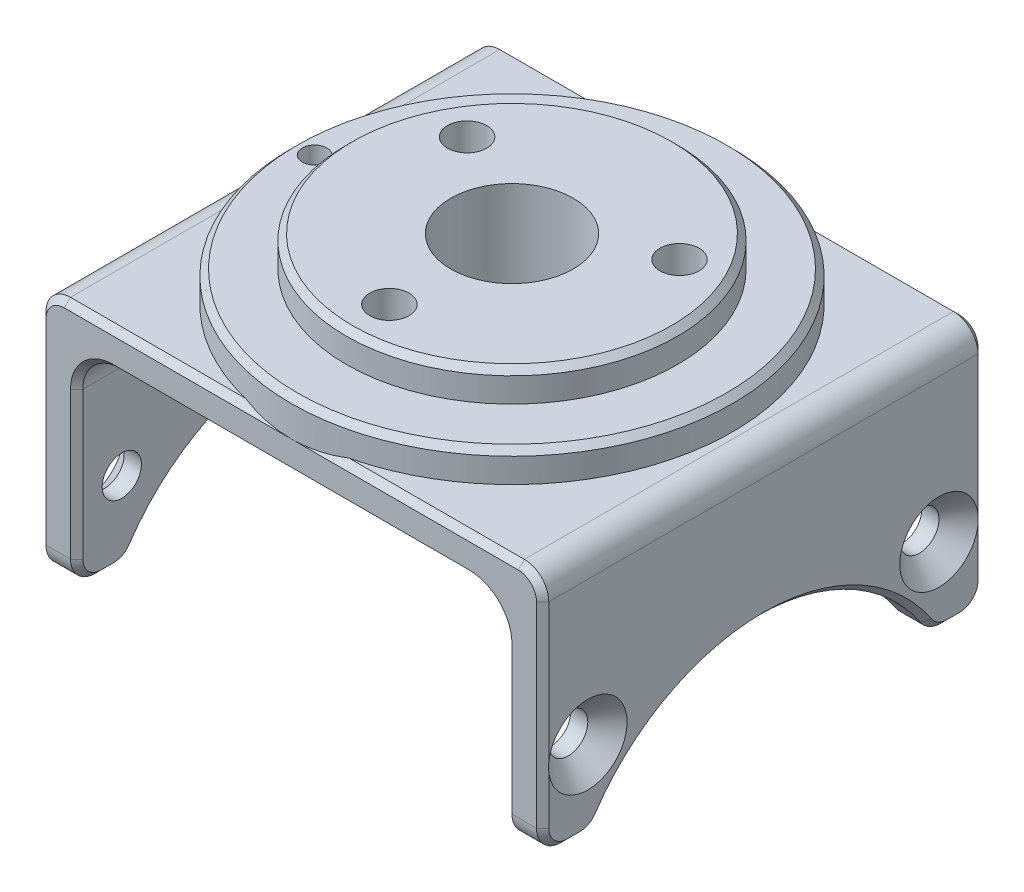
from build123d import *

# Parameters (mm, degrees)
EXTRUDE_1_DEPTH              = 18
SKETCH_3_R                   = 16
CUT_EXTRUDE_1_DEPTH          = 46
SKETCH_11_R                  = 13.5
EXTRUDE_2_DEPTH              = 5
SKETCH_12_R                  = 18
EXTRUDE_5_DEPTH              = 2.5
HOLE_WIZARD_M3_3_D           = 3.2
HOLE_WIZARD_M3_3_CSINK_D     = 6.4
HOLE_WIZARD_M3_3_CSINK_ANGLE = 90
SKETCH_9_R                   = 5
CUT_EXTRUDE_2_DEPTH          = 46
F_2_0MM_1_D                  = 2
F_2_0MM_1_DEPTH              = 4.2
F_2_0MM_1_TIP                = 0.600860619
HOLE_WIZARD_M3_1_D           = 3.2
HOLE_WIZARD_M3_1_DEPTH       = 6
HOLE_WIZARD_M3_1_CSINK_D     = 6.4
HOLE_WIZARD_M3_1_CSINK_ANGLE = 90
HOLE_WIZARD_M3_1_TIP         = 0.96137699
HOLE_WIZARD_M3_2_D           = 3.2
HOLE_WIZARD_M3_2_DEPTH       = 6
HOLE_WIZARD_M3_2_CSINK_D     = 6.4
HOLE_WIZARD_M3_2_CSINK_ANGLE = 90
HOLE_WIZARD_M3_2_TIP         = 0.96137699
FILLET_1_R                   = 2
FILLET_2_R                   = 3
FILLET_3_R                   = 2
CHAMFER_3_SIZE               = 0.5


with BuildPart() as part:
    # 草图2 → 凸台-拉伸1 (new, symmetric)
    with BuildSketch(Plane.XY):
        Polygon((17.5, 17), (17.5, 0), (20.5, 0), (20.5, 20), (-20.5, 20), (-20.5, 0), (-17.5, 0), (-17.5, 17), align=None)
    extrude(amount=EXTRUDE_1_DEPTH, both=True)

    # 草图3 → 切除-拉伸1 (cut)
    with BuildSketch(Plane(origin=(20.5, 0, 0), x_dir=(0, 0, -1), z_dir=(1, 0, 0))):
        with Locations((0, -8)):
            Circle(SKETCH_3_R)
    extrude(amount=-CUT_EXTRUDE_1_DEPTH, mode=Mode.SUBTRACT)

    # 草图11 → 凸台-拉伸2 (add)
    with BuildSketch(Plane(origin=(0, 20, 0), x_dir=(1, 0, 0), z_dir=(0, 1, 0))):
        with Locations(Location((0, 0, 0), (0, 0, 270))):
            Circle(SKETCH_11_R)
    extrude(amount=EXTRUDE_2_DEPTH)

    # 草图12 → 凸台-拉伸5 (add)
    with BuildSketch(Plane(origin=(0, 20, 0), x_dir=(1, 0, 0), z_dir=(0, 1, 0))):
        with Locations(Location((0, 0, 0), (0, 0, 270))):
            Circle(SKETCH_12_R)
    extrude(amount=EXTRUDE_5_DEPTH)

    # M3 开槽半沉头螺钉的锥形沉头孔3 (through all)
    with Locations(Plane.XZ.offset(-17)):
        with Locations((0, 10), (8.660254038, -5), (-8.660254038, -5)):
            CounterSinkHole(HOLE_WIZARD_M3_3_D / 2, HOLE_WIZARD_M3_3_CSINK_D / 2, counter_sink_angle=HOLE_WIZARD_M3_3_CSINK_ANGLE)

    # 草图9 → 切除-拉伸2 (cut)
    with BuildSketch(Plane.XZ.offset(-17)):
        with Locations(Location((0, 0, 0), (0, 0, 270))):
            Circle(SKETCH_9_R)
    extrude(amount=-CUT_EXTRUDE_2_DEPTH, mode=Mode.SUBTRACT)

    # Ø2.0mm 暗销孔1
    with Locations(Plane(origin=(0, 22.5, 0), x_dir=(1, 0, 0), z_dir=(0, 1, 0))):
        with Locations((-16.1, 0)):
            Hole(F_2_0MM_1_D / 2, depth=F_2_0MM_1_DEPTH)
            with Locations((0, 0, -(F_2_0MM_1_DEPTH + F_2_0MM_1_TIP / 2))):  # 118° drill point
                Cone(0, F_2_0MM_1_D / 2, F_2_0MM_1_TIP, mode=Mode.SUBTRACT)

    # M3 开槽半沉头螺钉的锥形沉头孔1
    with Locations(Plane(origin=(20.5, 0, 0), x_dir=(0, 0, -1), z_dir=(1, 0, 0))):
        with Locations((14.318912319, 6.318912319), (-14.318912319, 6.318912319)):
            CounterSinkHole(HOLE_WIZARD_M3_1_D / 2, HOLE_WIZARD_M3_1_CSINK_D / 2, depth=HOLE_WIZARD_M3_1_DEPTH, counter_sink_angle=HOLE_WIZARD_M3_1_CSINK_ANGLE)
            with Locations((0, 0, -(HOLE_WIZARD_M3_1_DEPTH + HOLE_WIZARD_M3_1_TIP / 2))):  # 118° drill point
                Cone(0, HOLE_WIZARD_M3_1_D / 2, HOLE_WIZARD_M3_1_TIP, mode=Mode.SUBTRACT)

    # M3 开槽半沉头螺钉的锥形沉头孔2
    with Locations(Plane.ZY.offset(20.5)):
        with Locations((-14.318912319, 6.318912319), (14.318912319, 6.318912319)):
            CounterSinkHole(HOLE_WIZARD_M3_2_D / 2, HOLE_WIZARD_M3_2_CSINK_D / 2, depth=HOLE_WIZARD_M3_2_DEPTH, counter_sink_angle=HOLE_WIZARD_M3_2_CSINK_ANGLE)
            with Locations((0, 0, -(HOLE_WIZARD_M3_2_DEPTH + HOLE_WIZARD_M3_2_TIP / 2))):  # 118° drill point
                Cone(0, HOLE_WIZARD_M3_2_D / 2, HOLE_WIZARD_M3_2_TIP, mode=Mode.SUBTRACT)

    # 圆角1
    fillet_1_edges = [part.edges().sort_by_distance(p)[0] for p in [
        (19, 0, -18),
        (19, 0, 18),
        (-19, 0, 18),
        (19, 0, 13.856406461),
        (19, 0, -13.856406461),
        (-19, 0, -13.856406461),
        (-19, 0, 13.856406461),
        (-19, 0, -18),
    ]]
    fillet(fillet_1_edges, radius=FILLET_1_R)

    # 圆角2
    fillet_2_edges = [part.edges().sort_by_distance(p)[0] for p in [
        (-17.5, 17, 0),
        (17.5, 17, 0),
    ]]
    fillet(fillet_2_edges, radius=FILLET_2_R)

    # 圆角3
    fillet_3_edges = [part.edges().sort_by_distance(p)[0] for p in [
        (-20.5, 20, 0),
        (20.5, 20, 0),
    ]]
    fillet(fillet_3_edges, radius=FILLET_3_R)

    # 倒角3
    # the kernel refuses this chamfer: 0.5 mm, written as the material it takes off along each edge
    with BuildSketch(Plane(origin=(20.5, 0, -16), x_dir=(0.02749587661058908, 0.9996219169112968, 0), z_dir=(0, 0, 1)), Plane(origin=(20.5, 0, 14.966629547), x_dir=(0.02749587661058908, 0.9996219169112968, 0), z_dir=(0, 0, 1))) as chamfer_3_piece_1:
        Polygon((CHAMFER_3_SIZE * 0.999621916911, CHAMFER_3_SIZE * 0.0274958766106), (-CHAMFER_3_SIZE * 0.0274958766106, CHAMFER_3_SIZE * 0.999621916911), (0, 0), align=None)
    extrude(amount=1.033370453, mode=Mode.SUBTRACT)
    with BuildSketch(Plane(origin=(17.5, 0, -16), x_dir=(-0.02749587661058908, 0.9996219169112968, 0), z_dir=(0, 0, 1)), Plane(origin=(17.5, 0, 14.966629547), x_dir=(-0.02749587661058908, 0.9996219169112968, 0), z_dir=(0, 0, 1)), Plane(origin=(-17.5, 0, -14.966629547), x_dir=(0.02749587661058908, 0.9996219169112968, 0), z_dir=(0, 0, -1)), Plane(origin=(-20.5, 0, -16), x_dir=(-0.02749587661058908, 0.9996219169112968, 0), z_dir=(0, 0, 1)), Plane(origin=(-17.5, 0, 16), x_dir=(0.02749587661058908, 0.9996219169112968, 0), z_dir=(0, 0, -1)), Plane(origin=(-20.5, 0, 14.966629547), x_dir=(-0.02749587661058908, 0.9996219169112968, 0), z_dir=(0, 0, 1))) as chamfer_3_piece_2:
        Polygon((CHAMFER_3_SIZE * 0.999621916911, -CHAMFER_3_SIZE * 0.0274958766106), (-CHAMFER_3_SIZE * 0.0274958766106, -CHAMFER_3_SIZE * 0.999621916911), (0, 0), align=None)
    extrude(amount=1.033370453, mode=Mode.SUBTRACT)
    with BuildSketch(Plane(origin=(20.5, -8, 0), x_dir=(0, 0.5555555555555556, -0.8314794192830981), z_dir=(0, -0.8314794192830981, -0.5555555555555556))) as chamfer_3_piece_3:
        Polygon((16 + CHAMFER_3_SIZE, 0), (16, -CHAMFER_3_SIZE), (16, 0), align=None)
    revolve(axis=Axis((20.5, -8, 0), (1, 0, 0)), revolution_arc=112.502022808, mode=Mode.SUBTRACT)
    with BuildSketch(Plane(origin=(20.5, 2, -18), x_dir=(0.027495876610589005, 0, 0.9996219169112968), z_dir=(0, 1, 0)), Plane(origin=(20.5, 2, 18), x_dir=(-0.9996219169112968, 0, 0.027495876610589005), z_dir=(0, 1, 0)), Plane(origin=(-20.5, 18, -18), x_dir=(-0.027495876610589005, 0, 0.9996219169112968), z_dir=(0, -1, 0)), Plane(origin=(-20.5, 18, 18), x_dir=(0.9996219169112968, 0, 0.027495876610589005), z_dir=(0, -1, 0))) as chamfer_3_piece_4:
        Polygon((CHAMFER_3_SIZE * 0.999621916911, -CHAMFER_3_SIZE * 0.0274958766106), (-CHAMFER_3_SIZE * 0.0274958766106, -CHAMFER_3_SIZE * 0.999621916911), (0, 0), align=None)
    extrude(amount=16, mode=Mode.SUBTRACT)
    with BuildSketch(Plane(origin=(20.5, 2, 16), x_dir=(0, -1, 0), z_dir=(0, 0, -1))) as chamfer_3_piece_5:
        Polygon((2 - CHAMFER_3_SIZE, 0), (2, CHAMFER_3_SIZE), (2, 0), align=None)
    revolve(axis=Axis((20.5, 2, 16), (-1, 0, 0)), revolution_arc=90, mode=Mode.SUBTRACT)
    with BuildSketch(Plane(origin=(20.5, 2, 14.966629547), x_dir=(0, -0.555555555555556, -0.8314794192830979), z_dir=(0, 0.8314794192830979, -0.555555555555556))) as chamfer_3_piece_6:
        Polygon((2 - CHAMFER_3_SIZE, 0), (2, CHAMFER_3_SIZE), (2, 0), align=None)
    revolve(axis=Axis((20.5, 2, 14.966629547), (-1, 0, 0)), revolution_arc=56.251011404, mode=Mode.SUBTRACT)
    with BuildSketch(Plane(origin=(20.5, 2, -14.966629547), x_dir=(0, -0.5555555555555557, 0.8314794192830981), z_dir=(0, 0.8314794192830981, 0.5555555555555557))) as chamfer_3_piece_7:
        Polygon((2 - CHAMFER_3_SIZE, 0), (2, -CHAMFER_3_SIZE), (2, 0), align=None)
    revolve(axis=Axis((20.5, 2, -14.966629547), (1, 0, 0)), revolution_arc=56.251011404, mode=Mode.SUBTRACT)
    with BuildSketch(Plane(origin=(20.5, 2, -16), x_dir=(0, -1, 0), z_dir=(0, 0, 1))) as chamfer_3_piece_8:
        Polygon((2 - CHAMFER_3_SIZE, 0), (2, -CHAMFER_3_SIZE), (2, 0), align=None)
    revolve(axis=Axis((20.5, 2, -16), (1, 0, 0)), revolution_arc=90, mode=Mode.SUBTRACT)
    with BuildSketch(Plane(origin=(-17.5, 2, -18), x_dir=(0.027495876610589005, 0, 0.9996219169112968), z_dir=(0, 1, 0)), Plane(origin=(-17.5, 2, 18), x_dir=(-0.9996219169112968, 0, 0.027495876610589005), z_dir=(0, 1, 0)), Plane(origin=(17.5, 14, -18), x_dir=(-0.027495876610589005, 0, 0.9996219169112968), z_dir=(0, -1, 0)), Plane(origin=(17.5, 14, 18), x_dir=(0.9996219169112968, 0, 0.027495876610589005), z_dir=(0, -1, 0))) as chamfer_3_piece_9:
        Polygon((CHAMFER_3_SIZE * 0.999621916911, -CHAMFER_3_SIZE * 0.0274958766106), (-CHAMFER_3_SIZE * 0.0274958766106, -CHAMFER_3_SIZE * 0.999621916911), (0, 0), align=None)
    extrude(amount=12, mode=Mode.SUBTRACT)
    with BuildSketch(Plane(origin=(17.5, -8, 0), x_dir=(0, 0.5555555555555556, -0.8314794192830981), z_dir=(0, -0.8314794192830981, -0.5555555555555556))) as chamfer_3_piece_10:
        Polygon((16 + CHAMFER_3_SIZE, 0), (16, CHAMFER_3_SIZE), (16, 0), align=None)
    revolve(axis=Axis((17.5, -8, 0), (1, 0, 0)), revolution_arc=112.502022808, mode=Mode.SUBTRACT)
    with BuildSketch(Plane(origin=(17.5, 2, 16), x_dir=(0, -1, 0), z_dir=(0, 0, -1))) as chamfer_3_piece_11:
        Polygon((2, -CHAMFER_3_SIZE), (2 - CHAMFER_3_SIZE, 0), (2, 0), align=None)
    revolve(axis=Axis((17.5, 2, 16), (-1, 0, 0)), revolution_arc=90, mode=Mode.SUBTRACT)
    with BuildSketch(Plane(origin=(17.5, 2, 14.966629547), x_dir=(0, -0.5555555555555564, -0.8314794192830977), z_dir=(0, 0.8314794192830977, -0.5555555555555564))) as chamfer_3_piece_12:
        Polygon((2 - CHAMFER_3_SIZE, 0), (2, -CHAMFER_3_SIZE), (2, 0), align=None)
    revolve(axis=Axis((17.5, 2, 14.966629547), (-1, 0, 0)), revolution_arc=56.251011404, mode=Mode.SUBTRACT)
    with BuildSketch(Plane(origin=(17.5, 2, -14.966629547), x_dir=(0, -0.5555555555555557, 0.8314794192830981), z_dir=(0, 0.8314794192830981, 0.5555555555555557))) as chamfer_3_piece_13:
        Polygon((2 - CHAMFER_3_SIZE, 0), (2, CHAMFER_3_SIZE), (2, 0), align=None)
    revolve(axis=Axis((17.5, 2, -14.966629547), (1, 0, 0)), revolution_arc=56.251011404, mode=Mode.SUBTRACT)
    with BuildSketch(Plane(origin=(17.5, 2, -16), x_dir=(0, -1, 0), z_dir=(0, 0, 1))) as chamfer_3_piece_14:
        Polygon((2 - CHAMFER_3_SIZE, 0), (2, CHAMFER_3_SIZE), (2, 0), align=None)
    revolve(axis=Axis((17.5, 2, -16), (1, 0, 0)), revolution_arc=90, mode=Mode.SUBTRACT)
    with BuildSketch(Plane(origin=(-17.5, -8, 0), x_dir=(0, 0.5555555555555556, -0.8314794192830981), z_dir=(0, -0.8314794192830981, -0.5555555555555556))) as chamfer_3_piece_15:
        Polygon((16 + CHAMFER_3_SIZE, 0), (16, -CHAMFER_3_SIZE), (16, 0), align=None)
    revolve(axis=Axis((-17.5, -8, 0), (1, 0, 0)), revolution_arc=112.502022808, mode=Mode.SUBTRACT)
    with BuildSketch(Plane(origin=(-17.5, 2, 16), x_dir=(0, -1, 0), z_dir=(0, 0, -1))) as chamfer_3_piece_16:
        Polygon((2, CHAMFER_3_SIZE), (2 - CHAMFER_3_SIZE, 0), (2, 0), align=None)
    revolve(axis=Axis((-17.5, 2, 16), (-1, 0, 0)), revolution_arc=90, mode=Mode.SUBTRACT)
    with BuildSketch(Plane(origin=(-17.5, 2, 14.966629547), x_dir=(0, -1, 0), z_dir=(0, 0, 1))) as chamfer_3_piece_17:
        Polygon((2 - CHAMFER_3_SIZE, 0), (2, -CHAMFER_3_SIZE), (2, 0), align=None)
    revolve(axis=Axis((-17.5, 2, 14.966629547), (1, 0, 0)), revolution_arc=56.251011404, mode=Mode.SUBTRACT)
    with BuildSketch(Plane(origin=(-17.5, 2, -14.966629547), x_dir=(0, -0.5555555555555557, 0.8314794192830981), z_dir=(0, 0.8314794192830981, 0.5555555555555557))) as chamfer_3_piece_18:
        Polygon((2 - CHAMFER_3_SIZE, 0), (2, -CHAMFER_3_SIZE), (2, 0), align=None)
    revolve(axis=Axis((-17.5, 2, -14.966629547), (1, 0, 0)), revolution_arc=56.251011404, mode=Mode.SUBTRACT)
    with BuildSketch(Plane(origin=(-17.5, 2, -16), x_dir=(0, -1, 0), z_dir=(0, 0, 1))) as chamfer_3_piece_19:
        Polygon((2 - CHAMFER_3_SIZE, 0), (2, -CHAMFER_3_SIZE), (2, 0), align=None)
    revolve(axis=Axis((-17.5, 2, -16), (1, 0, 0)), revolution_arc=90, mode=Mode.SUBTRACT)
    with BuildSketch(Plane(origin=(-20.5, -8, 0), x_dir=(0, 0.5555555555555556, -0.8314794192830981), z_dir=(0, -0.8314794192830981, -0.5555555555555556))) as chamfer_3_piece_20:
        Polygon((16 + CHAMFER_3_SIZE, 0), (16, CHAMFER_3_SIZE), (16, 0), align=None)
    revolve(axis=Axis((-20.5, -8, 0), (1, 0, 0)), revolution_arc=112.502022808, mode=Mode.SUBTRACT)
    with BuildSketch(Plane(origin=(-20.5, 2, 16), x_dir=(0, -1, 0), z_dir=(0, 0, -1))) as chamfer_3_piece_21:
        Polygon((2 - CHAMFER_3_SIZE, 0), (2, -CHAMFER_3_SIZE), (2, 0), align=None)
    revolve(axis=Axis((-20.5, 2, 16), (-1, 0, 0)), revolution_arc=90, mode=Mode.SUBTRACT)
    with BuildSketch(Plane(origin=(-20.5, 2, 14.966629547), x_dir=(0, -1, 0), z_dir=(0, 0, 1))) as chamfer_3_piece_22:
        Polygon((2 - CHAMFER_3_SIZE, 0), (2, CHAMFER_3_SIZE), (2, 0), align=None)
    revolve(axis=Axis((-20.5, 2, 14.966629547), (1, 0, 0)), revolution_arc=56.251011404, mode=Mode.SUBTRACT)
    with BuildSketch(Plane(origin=(-20.5, 2, -14.966629547), x_dir=(0, -0.5555555555555557, 0.8314794192830981), z_dir=(0, 0.8314794192830981, 0.5555555555555557))) as chamfer_3_piece_23:
        Polygon((2 - CHAMFER_3_SIZE, 0), (2, CHAMFER_3_SIZE), (2, 0), align=None)
    revolve(axis=Axis((-20.5, 2, -14.966629547), (1, 0, 0)), revolution_arc=56.251011404, mode=Mode.SUBTRACT)
    with BuildSketch(Plane(origin=(-20.5, 2, -16), x_dir=(0, -1, 0), z_dir=(0, 0, 1))) as chamfer_3_piece_24:
        Polygon((2 - CHAMFER_3_SIZE, 0), (2, CHAMFER_3_SIZE), (2, 0), align=None)
    revolve(axis=Axis((-20.5, 2, -16), (1, 0, 0)), revolution_arc=90, mode=Mode.SUBTRACT)
    with BuildSketch(Plane(origin=(-14.5, 17, -18), x_dir=(0, -0.027495876610589005, 0.9996219169112968), z_dir=(1, 0, 0)), Plane(origin=(-14.5, 17, 18), x_dir=(0, 0.9996219169112968, 0.027495876610589005), z_dir=(1, 0, 0))) as chamfer_3_piece_25:
        Polygon((CHAMFER_3_SIZE * 0.999621916911, -CHAMFER_3_SIZE * 0.0274958766106), (-CHAMFER_3_SIZE * 0.0274958766106, -CHAMFER_3_SIZE * 0.999621916911), (0, 0), align=None)
    extrude(amount=29, mode=Mode.SUBTRACT)
    with BuildSketch(Plane(origin=(-14.5, 14, -18), x_dir=(0, 1, 0), z_dir=(1, 0, 0))) as chamfer_3_piece_26:
        Polygon((3, CHAMFER_3_SIZE), (3 + CHAMFER_3_SIZE, 0), (3, 0), align=None)
    revolve(axis=Axis((-14.5, 14, -18), (0, 0, 1)), revolution_arc=90, mode=Mode.SUBTRACT)
    with BuildSketch(Plane(origin=(-14.5, 14, 18), x_dir=(0, 1, 0), z_dir=(1, 0, 0))) as chamfer_3_piece_27:
        Polygon((3 + CHAMFER_3_SIZE, 0), (3, -CHAMFER_3_SIZE), (3, 0), align=None)
    revolve(axis=Axis((-14.5, 14, 18), (0, 0, 1)), revolution_arc=90, mode=Mode.SUBTRACT)
    with BuildSketch(Plane(origin=(14.5, 14, -18), x_dir=(1, 0, 0), z_dir=(0, -1, 0))) as chamfer_3_piece_28:
        Polygon((3, CHAMFER_3_SIZE), (3 + CHAMFER_3_SIZE, 0), (3, 0), align=None)
    revolve(axis=Axis((14.5, 14, -18), (0, 0, 1)), revolution_arc=90, mode=Mode.SUBTRACT)
    with BuildSketch(Plane(origin=(14.5, 14, 18), x_dir=(1, 0, 0), z_dir=(0, -1, 0))) as chamfer_3_piece_29:
        Polygon((3 + CHAMFER_3_SIZE, 0), (3, -CHAMFER_3_SIZE), (3, 0), align=None)
    revolve(axis=Axis((14.5, 14, 18), (0, 0, 1)), revolution_arc=90, mode=Mode.SUBTRACT)
    with BuildSketch(Plane(origin=(18.5, 20, -18), x_dir=(0, 0.027495876610589005, 0.9996219169112968), z_dir=(-1, 0, 0))) as chamfer_3_piece_30_section:
        Polygon((CHAMFER_3_SIZE * 0.999621916911, -CHAMFER_3_SIZE * 0.0274958766106), (-CHAMFER_3_SIZE * 0.0274958766106, -CHAMFER_3_SIZE * 0.999621916911), (0, 0), align=None)
    chamfer_3_piece_30 = extrude(amount=18.499999993, mode=Mode.PRIVATE)
    chamfer_3_piece_30 = chamfer_3_piece_30 - Plane(origin=(0, 19.832051371, 0), x_dir=(0, 0, 1), z_dir=(0, -1, 0)) * Cylinder(18, 39, mode=Mode.PRIVATE)
    add(chamfer_3_piece_30, mode=Mode.SUBTRACT)
    with BuildSketch(Plane(origin=(18.5, 18, -18), x_dir=(1, 0, 0), z_dir=(0, -1, 0))) as chamfer_3_piece_31:
        Polygon((2, CHAMFER_3_SIZE), (2 - CHAMFER_3_SIZE, 0), (2, 0), align=None)
    revolve(axis=Axis((18.5, 18, -18), (0, 0, 1)), revolution_arc=90, mode=Mode.SUBTRACT)
    with BuildSketch(Plane(origin=(-18.5, 18, -18), x_dir=(0, 1, 0), z_dir=(1, 0, 0))) as chamfer_3_piece_32:
        Polygon((2, CHAMFER_3_SIZE), (2 - CHAMFER_3_SIZE, 0), (2, 0), align=None)
    revolve(axis=Axis((-18.5, 18, -18), (0, 0, 1)), revolution_arc=90, mode=Mode.SUBTRACT)
    with BuildSketch(Plane(origin=(18.5, 20, 18), x_dir=(0, -0.9996219169112968, 0.027495876610589005), z_dir=(-1, 0, 0))) as chamfer_3_piece_33_section:
        Polygon((CHAMFER_3_SIZE * 0.999621916911, -CHAMFER_3_SIZE * 0.0274958766106), (-CHAMFER_3_SIZE * 0.0274958766106, -CHAMFER_3_SIZE * 0.999621916911), (0, 0), align=None)
    chamfer_3_piece_33 = extrude(amount=18.5, mode=Mode.PRIVATE)
    chamfer_3_piece_33 = chamfer_3_piece_33 - Plane(origin=(0, 19.78751499, 0), x_dir=(0, 0, 1), z_dir=(0, -1, 0)) * Cylinder(18, 39, mode=Mode.PRIVATE)
    add(chamfer_3_piece_33, mode=Mode.SUBTRACT)
    with BuildSketch(Plane(origin=(18.5, 18, 18), x_dir=(1, 0, 0), z_dir=(0, -1, 0))) as chamfer_3_piece_34:
        Polygon((2 - CHAMFER_3_SIZE, 0), (2, -CHAMFER_3_SIZE), (2, 0), align=None)
    revolve(axis=Axis((18.5, 18, 18), (0, 0, 1)), revolution_arc=90, mode=Mode.SUBTRACT)
    with BuildSketch(Plane(origin=(-18.5, 18, 18), x_dir=(0, 1, 0), z_dir=(1, 0, 0))) as chamfer_3_piece_35:
        Polygon((2 - CHAMFER_3_SIZE, 0), (2, -CHAMFER_3_SIZE), (2, 0), align=None)
    revolve(axis=Axis((-18.5, 18, 18), (0, 0, 1)), revolution_arc=90, mode=Mode.SUBTRACT)
    with BuildSketch(Plane(origin=(0, 25, 0), x_dir=(0, 0, 1), z_dir=(-1, 0, 0))) as chamfer_3_piece_36:
        Polygon((13.5 - CHAMFER_3_SIZE, 0), (13.5, -CHAMFER_3_SIZE), (13.5, 0), align=None)
    revolve(axis=Axis((0, 25, 0), (0, 1, 0)), mode=Mode.SUBTRACT)
    with BuildSketch(Plane(origin=(7e-09, 20, -18), x_dir=(0, 0.027495876610589005, 0.9996219169112968), z_dir=(-1, 0, 0))) as chamfer_3_piece_37_section:
        Polygon((CHAMFER_3_SIZE * 0.999621916911, -CHAMFER_3_SIZE * 0.0274958766106), (-CHAMFER_3_SIZE * 0.0274958766106, -CHAMFER_3_SIZE * 0.999621916911), (0, 0), align=None)
    chamfer_3_piece_37 = extrude(amount=18.500000007, mode=Mode.PRIVATE)
    chamfer_3_piece_37 = chamfer_3_piece_37 - Plane(origin=(0, 19.832051367, 0), x_dir=(0, 0, 1), z_dir=(0, -1, 0)) * Cylinder(18, 39, mode=Mode.PRIVATE)
    add(chamfer_3_piece_37, mode=Mode.SUBTRACT)
    with BuildSketch(Plane(origin=(0, 20, 18), x_dir=(0, -0.9996219169112968, 0.027495876610589005), z_dir=(-1, 0, 0))) as chamfer_3_piece_38_section:
        Polygon((CHAMFER_3_SIZE * 0.999621916911, -CHAMFER_3_SIZE * 0.0274958766106), (-CHAMFER_3_SIZE * 0.0274958766106, -CHAMFER_3_SIZE * 0.999621916911), (0, 0), align=None)
    chamfer_3_piece_38 = extrude(amount=18.5, mode=Mode.PRIVATE)
    chamfer_3_piece_38 = chamfer_3_piece_38 - Plane(origin=(0, 19.832051366, 0), x_dir=(0, 0, 1), z_dir=(0, -1, 0)) * Cylinder(18, 39, mode=Mode.PRIVATE)
    add(chamfer_3_piece_38, mode=Mode.SUBTRACT)
    with BuildSketch(Plane(origin=(0, 22.5, 0), x_dir=(0, 0, 1), z_dir=(-1, 0, 0))) as chamfer_3_piece_39:
        Polygon((18, -CHAMFER_3_SIZE), (18 - CHAMFER_3_SIZE, 0), (18, 0), align=None)
    revolve(axis=Axis((0, 22.5, 0), (0, 1, 0)), mode=Mode.SUBTRACT)


solid = part.part
